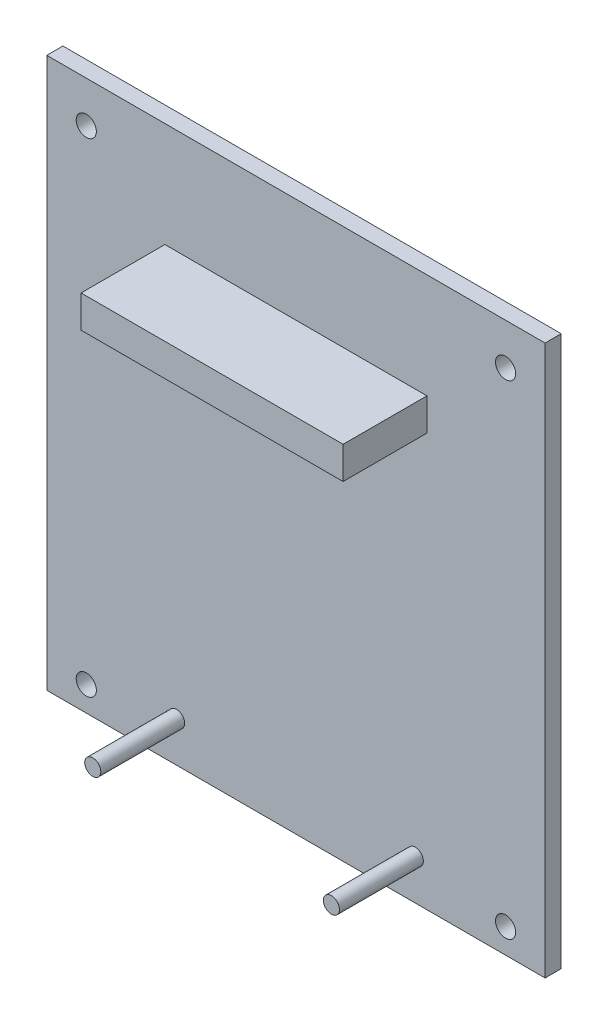
from build123d import *

# Parameters (mm, degrees)
SKETCH1_W           = 78.486
SKETCH1_H           = 86.614
SKETCH1_R           = 1.5875
BOSS_EXTRUDE1_DEPTH = 2.54
SKETCH2_R           = 1.27
SKETCH2_W           = 41.275
SKETCH2_H           = 5.08
BOSS_EXTRUDE2_DEPTH = 13.208


with BuildPart() as part:
    # Sketch1 → Boss-Extrude1 (new body)
    with BuildSketch(Plane.XY):
        with Locations((39.243, 43.307)):
            Rectangle(SKETCH1_W, SKETCH1_H)
        with Locations((6.223, 80.1116)):
            Circle(SKETCH1_R, mode=Mode.SUBTRACT)
        with Locations((72.263, 80.1116)):
            Circle(SKETCH1_R, mode=Mode.SUBTRACT)
        with Locations((72.263, 3.9116)):
            Circle(SKETCH1_R, mode=Mode.SUBTRACT)
        with Locations((6.223, 3.9116)):
            Circle(SKETCH1_R, mode=Mode.SUBTRACT)
    extrude(amount=BOSS_EXTRUDE1_DEPTH)

    # Sketch2 → Boss-Extrude2 (add)
    with BuildSketch(Plane.XY.offset(2.54)):
        with Locations((20.447, 6.35)):
            Circle(SKETCH2_R)
        with Locations((58.039, 6.35)):
            Circle(SKETCH2_R)
        with Locations((39.243, 67.564)):
            Rectangle(SKETCH2_W, SKETCH2_H)
    extrude(amount=BOSS_EXTRUDE2_DEPTH)


solid = part.part
